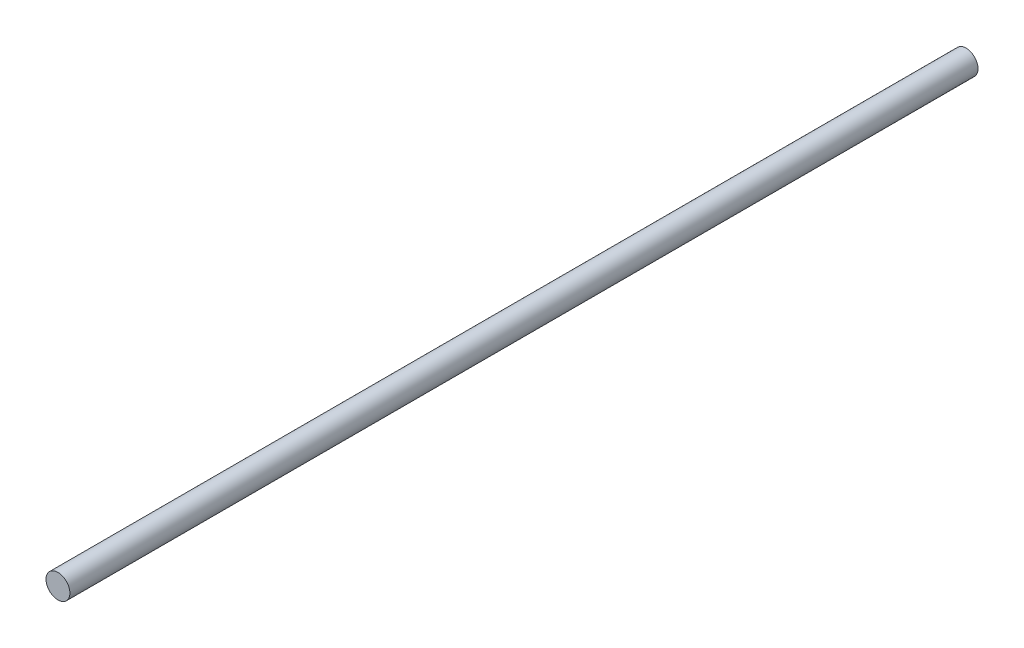
from build123d import *

# Parameters (mm, degrees)
ESQUISSE1_R        = 3.175
BOSS_EXTRU_1_DEPTH = 241.3


with BuildPart() as part:
    # Esquisse1 → Boss.-Extru.1 (new body)
    with BuildSketch(Plane.XY):
        Circle(ESQUISSE1_R)
    extrude(amount=BOSS_EXTRU_1_DEPTH)


solid = part.part
